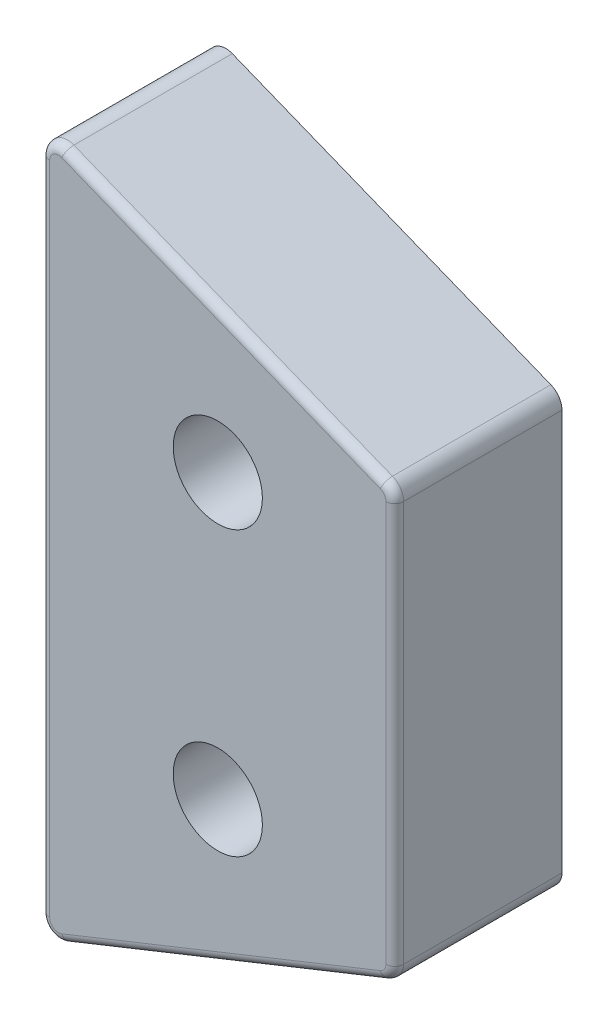
from build123d import *

# Parameters (mm, degrees)
SKETCH1_R           = 2
BOSS_EXTRUDE1_DEPTH = 7.5
FILLET1_R           = 0.79375
CUT_EXTRUDE1_DEPTH  = 4.25
FILLET2_R           = 0.396875


with BuildPart() as part:
    # Sketch1 → Boss-Extrude1 (new body)
    with BuildSketch(Plane.XY):
        Polygon((0, 0), (15.875, -6.35), (15.875, -25.4), (0, -31.75), align=None)
        with Locations((7.9375, -22.225)):
            Circle(SKETCH1_R, mode=Mode.SUBTRACT)
        with Locations((7.9375, -9.525)):
            Circle(SKETCH1_R, mode=Mode.SUBTRACT)
    extrude(amount=BOSS_EXTRUDE1_DEPTH)

    # Fillet1
    fillet1_edges = [part.edges().sort_by_distance(p)[0] for p in [
        (0, -31.75, 3.75),
        (15.875, -25.4, 3.75),
        (15.875, -6.35, 3.75),
        (0, 0, 3.75),
    ]]
    fillet(fillet1_edges, radius=FILLET1_R)

    # Sketch2 → Cut-Extrude1 (cut)
    with BuildSketch(Plane.XY.offset(7.5)):
        with BuildLine():
            Line((14.6875, -22.225), (14.6875, -25.875))
            Line((14.6875, -25.875), (1.1875, -31.275))
            Line((1.1875, -31.275), (1.1875, -22.225))
            ThreePointArc((1.1875, -22.225), (7.9375, -15.475), (14.6875, -22.225))
        make_face()
    extrude(amount=-CUT_EXTRUDE1_DEPTH, mode=Mode.SUBTRACT)

    # Fillet2
    fillet2_edges = [part.edges().sort_by_distance(p)[0] for p in [
        (15.738528364, -6.442395796, 0),
        (15.875, -15.875, 0),
        (15.738528364, -25.307604204, 0),
        (8.232291349, -28.45708346, 0),
        (0.348750883, -31.234883451, 0),
        (0, -15.875, 0),
        (0.348750883, -0.515116549, 0),
        (8.232291349, -3.29291654, 0),
    ]]
    fillet(fillet2_edges, radius=FILLET2_R)


with BuildPart() as body_2:
    # Mirror1: mirrored copy
    add(part.part.mirror(Plane(origin=(0, 0, 0), x_dir=(1, 0, 0), z_dir=(0, 0, -1))))


solid = body_2.part
